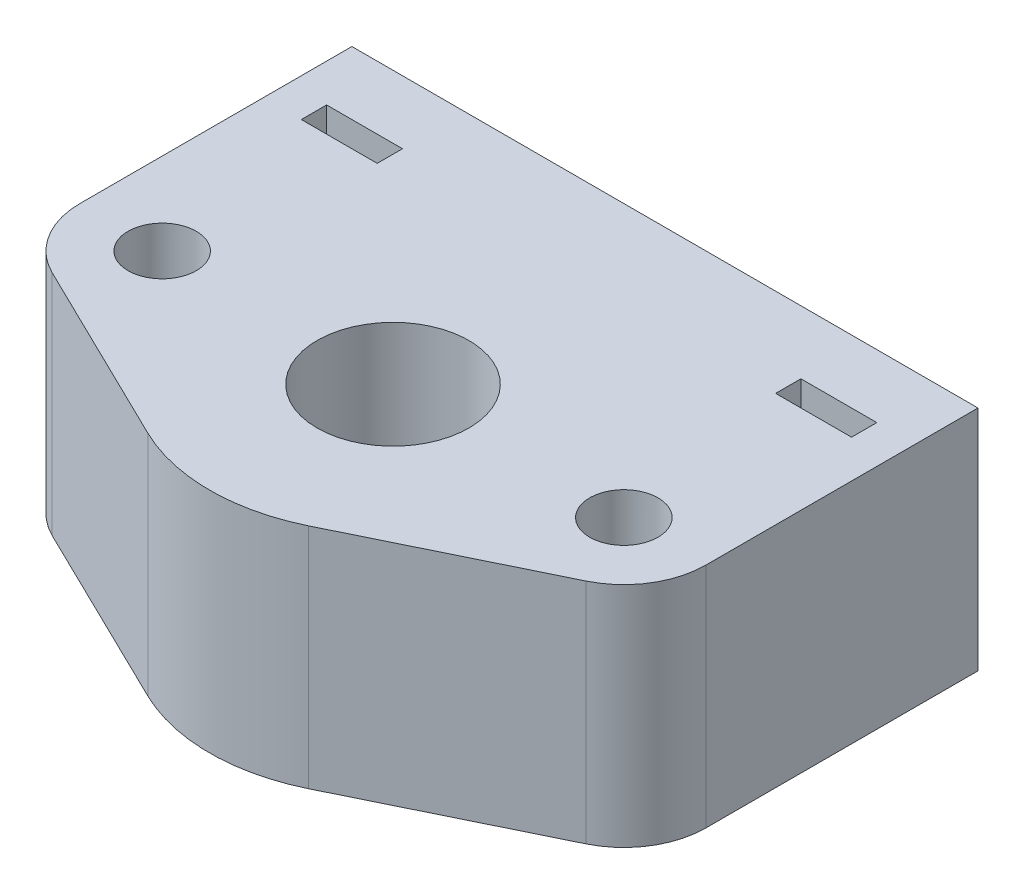
from build123d import *
from build123d.topology import SkipClean

# Parameters (mm, degrees)
BOSS_EXTRUDE1_DEPTH      = 12
BOSS_EXTRUDE1_DEPTH_BACK = 6
SKETCH1_R                = 2.7
SKETCH3_R                = 1.7
CUT_EXTRUDE1_DEPTH       = 10
CUT_EXTRUDE2_START       = -5
CUT_EXTRUDE2_DEPTH       = 2
CUT_EXTRUDE3_DEPTH       = 10


with BuildPart() as part:
    # Sketch1 → Boss-Extrude1 (new, two sides: drawn at the far end of the back side and taken through both)
    with BuildSketch(Plane(origin=(0, 0, 0), x_dir=(1, 0, 0), z_dir=(0, 1, 0)).offset(-BOSS_EXTRUDE1_DEPTH_BACK)):
        with BuildLine():
            Line((-24.75, 0), (-24.75, -21.5))
            ThreePointArc((-24.75, -21.5), (-23.762283916, -24.944521161), (-21.099315068, -27.342208798))
            Line((-21.099315068, -27.342208798), (-6.356164384, -34.532619627))
            ThreePointArc((-6.356164384, -34.532619627), (-3.261672532, -35.628393125), (0, -36))
            Line((0, -36), (0, -27.5))
            ThreePointArc((0, -27.5), (-6, -21.5), (0, -15.5))
            Line((0, -15.5), (0, 0))
            Line((0, 0), (-24.75, 0))
        make_face()
        with Locations((-18.25, -21.5)):
            Circle(SKETCH1_R, mode=Mode.SUBTRACT)
    extrude(amount=BOSS_EXTRUDE1_DEPTH + BOSS_EXTRUDE1_DEPTH_BACK)

    # Sketch3 → Cut-Extrude1 (cut)
    with BuildSketch(Plane(origin=(0, 0, 0), x_dir=(-1, 0, 0), z_dir=(0, 0, -1))):
        with Locations((18.75, 6)):
            Circle(SKETCH3_R)
        with BuildLine():
            Line((0, 1.7), (0, -1.7))
            ThreePointArc((0, -1.7), (1.7, 0), (0, 1.7))
        make_face()
    extrude(amount=-CUT_EXTRUDE1_DEPTH, mode=Mode.SUBTRACT)

    # Sketch4 → Cut-Extrude2 (cut)
    with BuildSketch(Plane(origin=(0, 0, 0), x_dir=(-1, 0, 0), z_dir=(0, 0, -1)).offset(CUT_EXTRUDE2_START)):
        Polygon((15.75, 9), (15.75, 12), (21.75, 12), (21.75, 9), (21.75, 3), (15.75, 3), align=None)
        Polygon((0, 3), (3, 3), (3, 0), (3, -6), (0, -6), align=None)
    extrude(amount=-CUT_EXTRUDE2_DEPTH, mode=Mode.SUBTRACT)

    # Sketch6 → Cut-Extrude3 (cut)
    with BuildSketch(Plane.XZ.offset(6)):
        Polygon((-14, 23.953738644), (-18.25, 26.407477288), (-22.5, 23.953738644), (-22.5, 19.046261356), (-18.25, 16.592522712), (-14, 19.046261356), align=None)
    extrude(amount=-CUT_EXTRUDE3_DEPTH, mode=Mode.SUBTRACT)

    # Mirror1: part across plane


with BuildPart() as part_1:
    with SkipClean():  # the faces are left unmerged after this step: merging them gives an invalid solid
        add(part.part)
        add(part.part.mirror(Plane(origin=(0, -6, 0), x_dir=(0, 0, 1), z_dir=(1, 0, 0))))


solid = part_1.part
